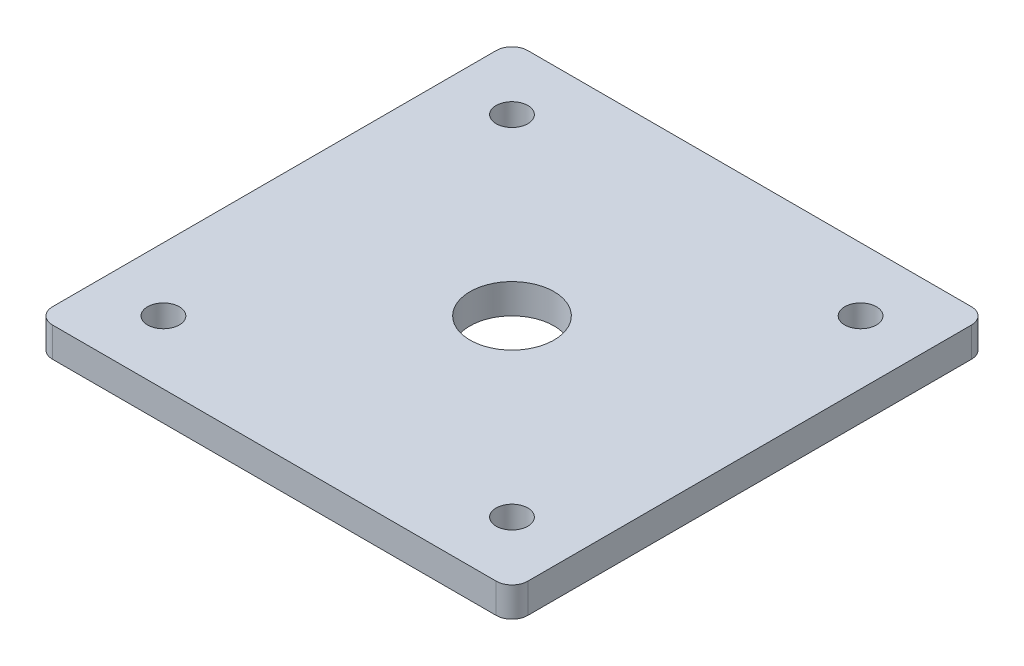
from build123d import *

# Parameters (mm, degrees)
SKETCH2_W           = 38.1
SKETCH2_H           = 38.1
SKETCH2_R           = 1.27
SKETCH2_R_2         = 3.3655
BOSS_EXTRUDE1_DEPTH = 2.38125
FILLET1_R           = 1.27


with BuildPart() as part:
    # Sketch2 → Boss-Extrude1 (new body)
    with BuildSketch(Plane(origin=(0, 0, 0), x_dir=(1, 0, 0), z_dir=(0, 1, 0))):
        Rectangle(SKETCH2_W, SKETCH2_H)
        with Locations((-13.97, 13.97)):
            Circle(SKETCH2_R, mode=Mode.SUBTRACT)
        with Locations((-13.97, -13.97)):
            Circle(SKETCH2_R, mode=Mode.SUBTRACT)
        with Locations((13.97, -13.97)):
            Circle(SKETCH2_R, mode=Mode.SUBTRACT)
        with Locations((13.97, 13.97)):
            Circle(SKETCH2_R, mode=Mode.SUBTRACT)
        Circle(SKETCH2_R_2, mode=Mode.SUBTRACT)
    extrude(amount=BOSS_EXTRUDE1_DEPTH)

    # Fillet1
    fillet1_edges = [part.edges().sort_by_distance(p)[0] for p in [
        (-19.05, 1.190625, -19.05),
        (19.05, 1.190625, -19.05),
        (19.05, 1.190625, 19.05),
        (-19.05, 1.190625, 19.05),
    ]]
    fillet(fillet1_edges, radius=FILLET1_R)


solid = part.part
